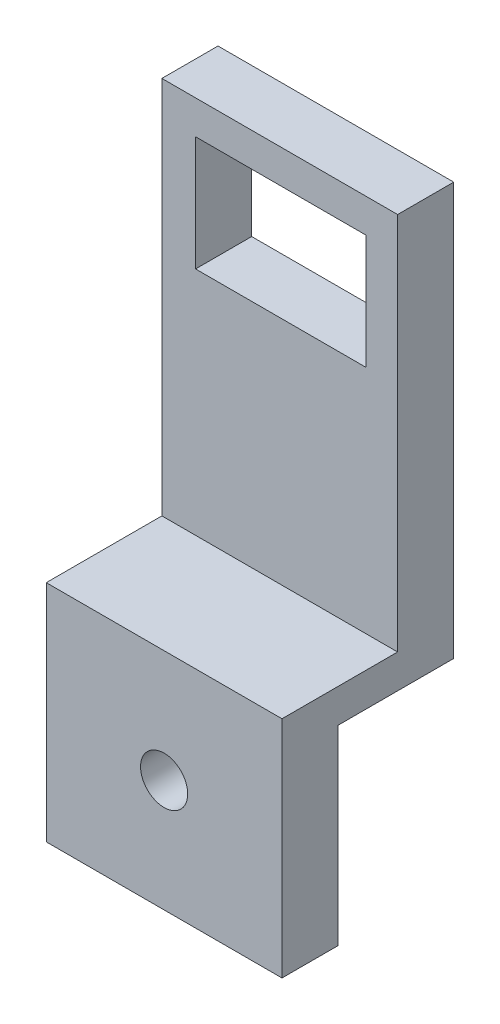
from build123d import *

# Parameters (mm, degrees)
SKETCH1_W           = 21
SKETCH1_H           = 53.75
SKETCH1_R           = 2.1
SKETCH1_W_2         = 15.2
SKETCH1_H_2         = 10.2
BOSS_EXTRUDE1_DEPTH = 15.3
SKETCH2_W           = 10.3
SKETCH2_H           = 33.75
SKETCH2_H_2         = 17
CUT_EXTRUDE1_DEPTH  = 21


with BuildPart() as part:
    # Sketch1 → Boss-Extrude1 (new body)
    with BuildSketch(Plane.XY):
        with Locations((10.5, 26.875)):
            Rectangle(SKETCH1_W, SKETCH1_H)
        with Locations((10.5, 10)):
            Circle(SKETCH1_R, mode=Mode.SUBTRACT)
        with Locations((10.6, 45.65)):
            Rectangle(SKETCH1_W_2, SKETCH1_H_2, mode=Mode.SUBTRACT)
    extrude(amount=BOSS_EXTRUDE1_DEPTH)

    # Sketch2 → Cut-Extrude1 (cut)
    with BuildSketch(Plane.ZY):
        with Locations((10.15, 36.875)):
            Rectangle(SKETCH2_W, SKETCH2_H)
        with Locations((5.15, 8.5)):
            Rectangle(SKETCH2_W, SKETCH2_H_2)
    extrude(amount=-CUT_EXTRUDE1_DEPTH, mode=Mode.SUBTRACT)


solid = part.part
